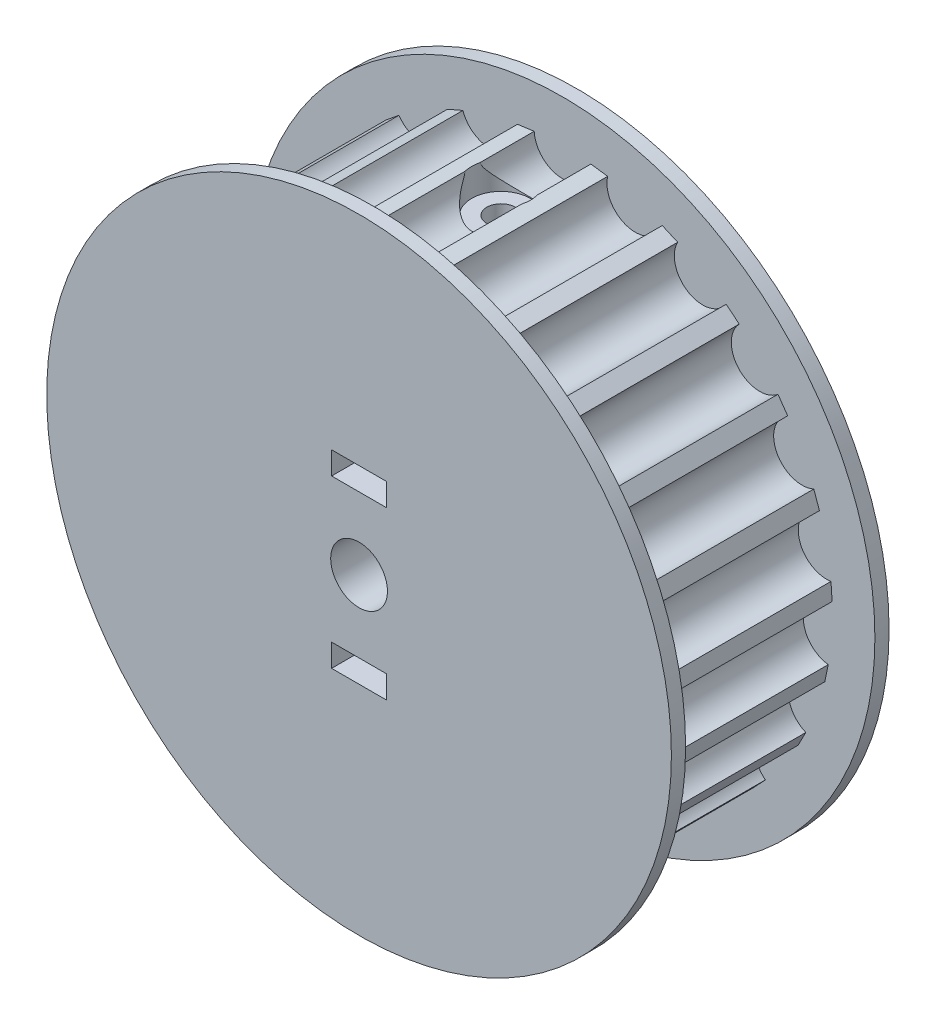
from build123d import *

# Parameters (mm, degrees)
SKETCH1_R             = 33
BOSS_EXTRUDE1_DEPTH   = 1.5
BOSS_EXTRUDE2_DEPTH   = 20
SKETCH3_R             = 33
BOSS_EXTRUDE3_DEPTH   = 1.5
SKETCH4_R             = 3
CUT_EXTRUDE1_DEPTH    = 53.028838157
CUT_EXTRUDE2_REACH    = 54.029
SKETCH5_R             = 2
CIRPATTERN1_COUNT     = 2
CIRPATTERN1_ANGLE     = 90
BOSS_EXTRUDE4_START   = -6.4
SKETCH7_R             = 2.040240194
SKETCH7_R_2           = 1.5
BOSS_EXTRUDE4_DEPTH   = 21.8
CUT_EXTRUDE3_DEPTH    = 2.4
SKETCH8_R             = 3.1
CUT_EXTRUDE4_DEPTH    = 15.4
MIRROR1_START         = -10
MIRROR1_DEPTH         = 2.4
MIRROR1_START_2       = -28.486059131
MIRROR1_2_OUTLINE_R   = 1.5
MIRROR1_2_DEPTH       = 26.249991264
MIRROR1_3_OUTLINE_R   = 1.5
MIRROR1_3_DEPTH       = 3.086059131
MIRROR1_START_3       = -3.6
MIRROR1_4_OUTLINE_R   = 2
MIRROR1_4_OUTLINE_R_2 = 1.5
MIRROR1_4_DEPTH       = 1.363932133


# Read off the part's stored shape, not the designer's step: Mirror1
with BuildPart() as part:
    # Sketch1 → Boss-Extrude1 (new body)
    with BuildSketch(Plane.XY):
        Circle(SKETCH1_R)
    extrude(amount=BOSS_EXTRUDE1_DEPTH)

    # Sketch2 → Boss-Extrude2 (add)
    with BuildSketch(Plane.XY.offset(1.5)):
        with BuildLine():
            Line((-18.66860846, 21.534462105), (-17.285808537, 22.659453286))
            ThreePointArc((-17.285808537, 22.659453286), (-13.249390726, 21.787694816), (-12.166397472, 25.772636119))
            Line((-12.166397472, 25.772636119), (-10.531356534, 26.482834621))
            ThreePointArc((-10.531356534, 26.482834621), (-6.879817665, 24.554390827), (-4.761860442, 28.099371615))
            Line((-4.761860442, 28.099371615), (-2.995841994, 28.342105263))
            ThreePointArc((-2.995841994, 28.342105263), (0, 25.5), (2.995841994, 28.342105263))
            Line((2.995841994, 28.342105263), (4.761860442, 28.099371615))
            ThreePointArc((4.761860442, 28.099371615), (6.879817665, 24.554390827), (10.531356534, 26.482834621))
            Line((10.531356534, 26.482834621), (12.166397472, 25.772636119))
            ThreePointArc((12.166397472, 25.772636119), (13.249390726, 21.787694816), (17.285808537, 22.659453286))
            Line((17.285808537, 22.659453286), (18.66860846, 21.534462105))
            ThreePointArc((18.66860846, 21.534462105), (18.636317089, 17.405105152), (22.758251199, 17.15552396))
            Line((22.758251199, 17.15552396), (23.786254162, 15.69917555))
            ThreePointArc((23.786254162, 15.69917555), (22.641073069, 11.731658462), (26.542818481, 10.379247904))
            Line((26.542818481, 10.379247904), (27.139782207, 8.699552964))
            ThreePointArc((27.139782207, 8.699552964), (24.966644236, 5.188128333), (28.358826342, 2.833190513))
            Line((28.358826342, 2.833190513), (28.480476762, 1.054724332))
            ThreePointArc((28.480476762, 1.054724332), (25.440553614, -1.740181541), (28.071589786, -4.922991658))
            Line((28.071589786, -4.922991658), (27.708904645, -6.668328379))
            ThreePointArc((27.708904645, -6.668328379), (24.027653514, -8.53943011), (25.702411835, -12.314058058))
            Line((25.702411835, -12.314058058), (24.882289831, -13.896821679))
            ThreePointArc((24.882289831, -13.896821679), (20.832732272, -14.705348214), (21.427003579, -18.791847106))
            Line((21.427003579, -18.791847106), (20.210269408, -20.09465129))
            ThreePointArc((20.210269408, -20.09465129), (16.09274258, -19.780637913), (15.562452489, -23.87593082))
            Line((15.562452489, -23.87593082), (14.03934576, -24.80215254))
            ThreePointArc((14.03934576, -24.80215254), (10.159227791, -23.388888188), (8.543705491, -27.189245971))
            Line((8.543705491, -27.189245971), (6.827188062, -27.6701916))
            ThreePointArc((6.827188062, -27.6701916), (3.472249552, -25.262491624), (0.891310942, -28.486059131))
            Line((0.891310942, -28.486059131), (-0.891310942, -28.486059131))
            ThreePointArc((-0.891310942, -28.486059131), (-3.472249552, -25.262491624), (-6.827188062, -27.6701916))
            Line((-6.827188062, -27.6701916), (-8.543705491, -27.189245971))
            ThreePointArc((-8.543705491, -27.189245971), (-10.159227791, -23.388888188), (-14.03934576, -24.80215254))
            Line((-14.03934576, -24.80215254), (-15.562452489, -23.87593082))
            ThreePointArc((-15.562452489, -23.87593082), (-16.09274258, -19.780637913), (-20.210269408, -20.09465129))
            Line((-20.210269408, -20.09465129), (-21.427003579, -18.791847106))
            ThreePointArc((-21.427003579, -18.791847106), (-20.832732272, -14.705348214), (-24.882289831, -13.896821679))
            Line((-24.882289831, -13.896821679), (-25.702411835, -12.314058058))
            ThreePointArc((-25.702411835, -12.314058058), (-24.027653514, -8.53943011), (-27.708904645, -6.668328379))
            Line((-27.708904645, -6.668328379), (-28.071589786, -4.922991658))
            ThreePointArc((-28.071589786, -4.922991658), (-25.440553614, -1.740181541), (-28.480476762, 1.054724332))
            Line((-28.480476762, 1.054724332), (-28.358826342, 2.833190513))
            ThreePointArc((-28.358826342, 2.833190513), (-24.966644236, 5.188128333), (-27.139782207, 8.699552964))
            Line((-27.139782207, 8.699552964), (-26.542818481, 10.379247904))
            ThreePointArc((-26.542818481, 10.379247904), (-22.641073069, 11.731658462), (-23.786254162, 15.69917555))
            Line((-23.786254162, 15.69917555), (-22.758251199, 17.15552396))
            ThreePointArc((-22.758251199, 17.15552396), (-18.636317089, 17.405105152), (-18.66860846, 21.534462105))
        make_face()
    extrude(amount=BOSS_EXTRUDE2_DEPTH)

    # Sketch3 → Boss-Extrude3 (add)
    with BuildSketch(Plane.XY.offset(21.5)):
        Circle(SKETCH3_R)
    extrude(amount=BOSS_EXTRUDE3_DEPTH)

    # Sketch4 → Cut-Extrude1 (cut, through all)
    with BuildSketch(Plane(origin=(0, 0, 0), x_dir=(-1, 0, 0), z_dir=(0, 0, -1))):
        Circle(SKETCH4_R)
    extrude(amount=-CUT_EXTRUDE1_DEPTH, mode=Mode.SUBTRACT)

    # Sketch5 → Cut-Extrude2 (cut, up to next)
    with BuildSketch(Plane(origin=(0, 0, 0), x_dir=(0, 0, -1), z_dir=(1, 0, 0)), mode=Mode.PRIVATE) as cut_extrude2_sk1:
        with Locations((-8, 0)):
            Circle(SKETCH5_R)
    cut_extrude2_tool1 = extrude(cut_extrude2_sk1.sketch, amount=-CUT_EXTRUDE2_REACH, mode=Mode.PRIVATE) & part.part
    cut_extrude2 = cut_extrude2_tool1.solids().sort_by_distance((0, 0, 8))[0]
    add(cut_extrude2, mode=Mode.SUBTRACT)

    # CirPattern1: Cut-Extrude2; each copy of Cut-Extrude2 runs up to whatever stops it at its own place
    cirpattern1_before = part.part  # the part as the pattern finds it: every copy runs up to it
    cirpattern1_cut_extrude2_long = extrude(cut_extrude2_sk1.sketch, amount=-CUT_EXTRUDE2_REACH, mode=Mode.PRIVATE)
    cirpattern1_cut_extrude2_tool1 = cirpattern1_cut_extrude2_long.rotate(Axis((0, 0, 23), (0, 0, -1)), 1 * CIRPATTERN1_ANGLE / (CIRPATTERN1_COUNT - 1)) & cirpattern1_before
    add(cirpattern1_cut_extrude2_tool1.solids().sort_by_distance((0, 0, 8))[0], mode=Mode.SUBTRACT)

    # Sketch7 → Boss-Extrude4 (add)
    with BuildSketch(Plane(origin=(0, 10, 0), x_dir=(1, 0, 0), z_dir=(0, 1, 0)).offset(BOSS_EXTRUDE4_START)):
        with Locations((0, -8)):
            Circle(SKETCH7_R)
        with Locations(Location((0, -8, 0), (0, 0, 270))):
            Circle(SKETCH7_R_2, mode=Mode.SUBTRACT)
    extrude(amount=BOSS_EXTRUDE4_DEPTH)

    # Sketch6 → Cut-Extrude3 (cut)
    with BuildSketch(Plane(origin=(0, 10, 0), x_dir=(1, 0, 0), z_dir=(0, 1, 0))):
        Polygon((2.9, -24.24742132), (2.9, -6.547825059), (0, -4.25), (-2.9, -6.547825059), (-2.9, -24.24742132), align=None)
    extrude(amount=-CUT_EXTRUDE3_DEPTH, mode=Mode.SUBTRACT)

    # Sketch8 → Cut-Extrude4 (cut)
    with BuildSketch(Plane(origin=(0, 25.4, 0), x_dir=(1, 0, 0), z_dir=(0, 1, 0))):
        with Locations(Location((0, -8, 0), (0, 0, 14.894525561))):
            Circle(SKETCH8_R)
    extrude(amount=CUT_EXTRUDE4_DEPTH, mode=Mode.SUBTRACT)

    # Mirror1 outline → Mirror1 (cut)
    with BuildSketch(Plane(origin=(0, 0, 0), x_dir=(1, 0, 0), z_dir=(0, 1, 0)).offset(MIRROR1_START)):
        Polygon((-2.9, -24), (2.9, -24), (2.9, -6.547825059), (0, -4.25), (-2.9, -6.547825059), align=None)
    extrude(amount=MIRROR1_DEPTH, mode=Mode.SUBTRACT)

    # Mirror1 2 outline → Mirror1 2 (cut)
    with BuildSketch(Plane(origin=(0, 0, 0), x_dir=(1, 0, 0), z_dir=(0, 1, 0)).offset(MIRROR1_START_2)):
        with Locations((0, -8)):
            Circle(MIRROR1_2_OUTLINE_R)
    extrude(amount=MIRROR1_2_DEPTH, mode=Mode.SUBTRACT)

    # Mirror1 3 outline → Mirror1 3 (cut)
    with BuildSketch(Plane(origin=(0, 0, 0), x_dir=(1, 0, 0), z_dir=(0, 1, 0)).offset(MIRROR1_START_2)):
        with BuildLine():
            Line((-2.9, -6.90454363), (-2.9, -9.09545637))
            Line((-2.9, -9.09545637), (-2.898237745, -9.100099074))
            ThreePointArc((-2.898237745, -9.100099074), (0, -11.1), (2.898237745, -9.100099074))
            Line((2.898237745, -9.100099074), (2.9, -9.09545637))
            Line((2.9, -9.09545637), (2.9, -6.90454363))
            Line((2.9, -6.90454363), (2.898237745, -6.899900926))
            ThreePointArc((2.898237745, -6.899900926), (0, -4.9), (-2.898237745, -6.899900926))
            Line((-2.898237745, -6.899900926), (-2.9, -6.90454363))
        make_face()
        with Locations((0, -8)):
            Circle(MIRROR1_3_OUTLINE_R, mode=Mode.SUBTRACT)
    extrude(amount=MIRROR1_3_DEPTH, mode=Mode.SUBTRACT)

    # Mirror1 4 outline → Mirror1 4 (cut)
    with BuildSketch(Plane(origin=(0, 0, 0), x_dir=(1, 0, 0), z_dir=(0, 1, 0)).offset(MIRROR1_START_3)):
        with Locations((0, -8)):
            Circle(MIRROR1_4_OUTLINE_R)
        with Locations((0, -8)):
            Circle(MIRROR1_4_OUTLINE_R_2, mode=Mode.SUBTRACT)
    extrude(amount=MIRROR1_4_DEPTH, mode=Mode.SUBTRACT)


solid = part.part
